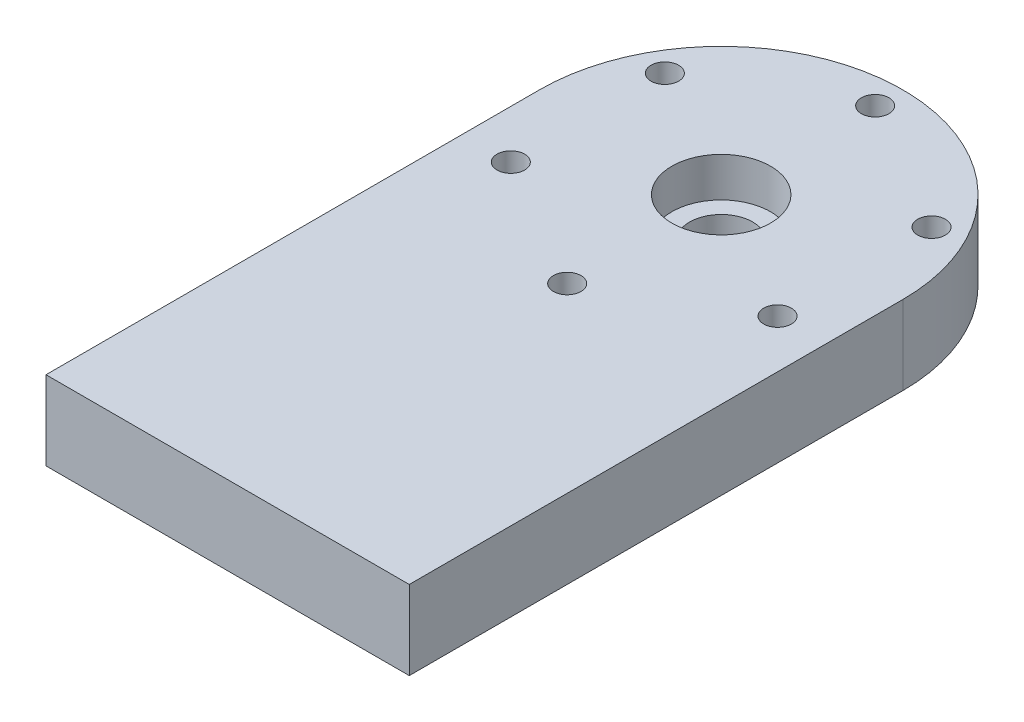
from build123d import *

# Parameters (mm, degrees)
BOSS_EXTRUDE1_DEPTH = 40
SKETCH5_R           = 25
CUT_EXTRUDE1_DEPTH  = 20
SKETCH6_R           = 16
CUT_EXTRUDE2_DEPTH  = 20
SKETCH7_R           = 7
CUT_EXTRUDE3_DEPTH  = 25
CIRPATTERN1_COUNT   = 6
SKETCH8_R           = 12
CUT_EXTRUDE4_DEPTH  = 15
CIRPATTERN2_COUNT   = 6


with BuildPart() as part:
    # Sketch3 → Boss-Extrude1 (new body)
    with BuildSketch(Plane(origin=(0, 0, 0), x_dir=(1, 0, 0), z_dir=(0, 1, 0))):
        with BuildLine():
            Line((0, 0), (184, 0))
            Line((184, 0), (184, 250))
            ThreePointArc((184, 250), (92, 342), (0, 250))
            Line((0, 250), (0, 0))
        make_face()
    extrude(amount=BOSS_EXTRUDE1_DEPTH)

    # Sketch5 → Cut-Extrude1 (cut)
    with BuildSketch(Plane(origin=(0, 40, 0), x_dir=(1, 0, 0), z_dir=(0, 1, 0))):
        with Locations((92, 250)):
            Circle(SKETCH5_R)
    extrude(amount=-CUT_EXTRUDE1_DEPTH, mode=Mode.SUBTRACT)

    # Sketch6 → Cut-Extrude2 (cut)
    with BuildSketch(Plane.XZ):
        with Locations((92, -250)):
            Circle(SKETCH6_R)
    extrude(amount=-CUT_EXTRUDE2_DEPTH, mode=Mode.SUBTRACT)

    # Sketch7 → Cut-Extrude3 (cut)
    with BuildSketch(Plane(origin=(0, 40, 0), x_dir=(1, 0, 0), z_dir=(0, 1, 0))):
        with Locations((92, 328)):
            Circle(SKETCH7_R)
    cut_extrude3 = extrude(amount=-CUT_EXTRUDE3_DEPTH, mode=Mode.SUBTRACT)

    # CirPattern1: Cut-Extrude3 ×6 about axis
    cirpattern1_axis = Axis((92, 40, -250), (0, 1, 0))
    for i in range(1, CIRPATTERN1_COUNT):
        add(cut_extrude3.rotate(cirpattern1_axis, i * 360 / CIRPATTERN1_COUNT), mode=Mode.SUBTRACT)

    # Sketch8 → Cut-Extrude4 (cut)
    with BuildSketch(Plane.XZ):
        with Locations((92, -328)):
            Circle(SKETCH8_R)
    cut_extrude4 = extrude(amount=-CUT_EXTRUDE4_DEPTH, mode=Mode.SUBTRACT)

    # CirPattern2: Cut-Extrude4 ×6 about axis
    cirpattern2_axis = Axis((92, 0, -250), (0, 1, 0))
    for i in range(1, CIRPATTERN2_COUNT):
        add(cut_extrude4.rotate(cirpattern2_axis, i * 360 / CIRPATTERN2_COUNT), mode=Mode.SUBTRACT)


solid = part.part
